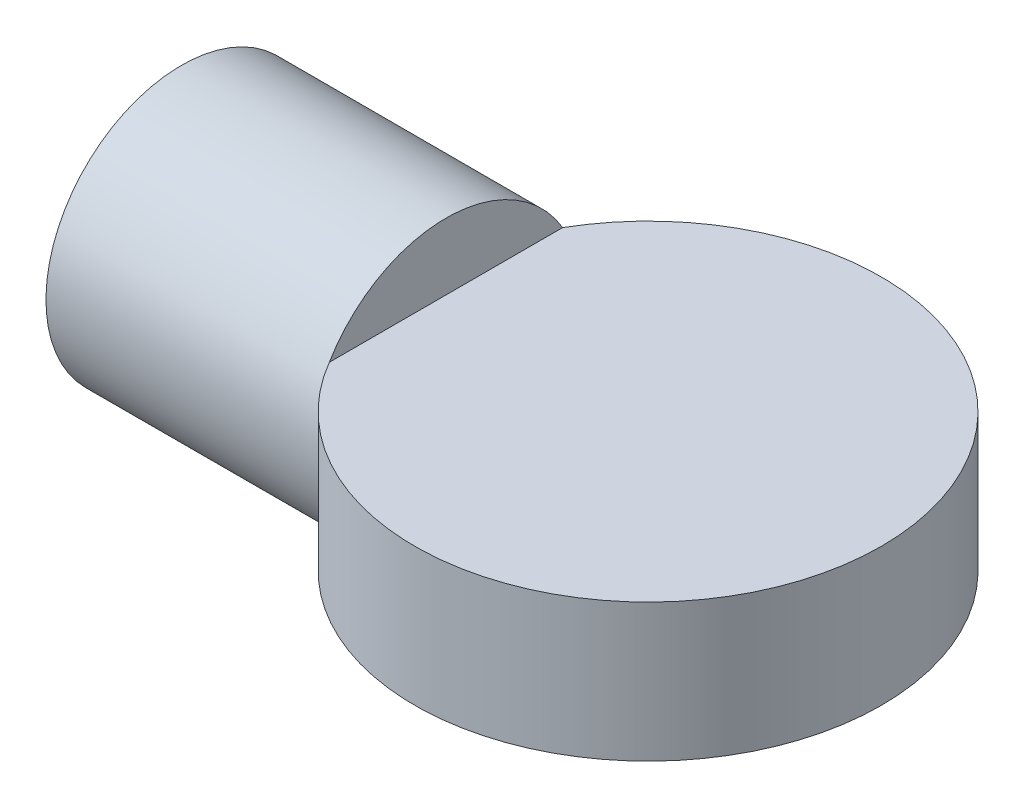
from build123d import *

# Parameters (mm, degrees)
BOSS_EXTRUDE1_DEPTH = 30
BOSS_EXTRUDE4_DEPTH = 57.60590949
BOSS_EXTRUDE5_DEPTH = 60.60590949


with BuildPart() as part:
    # Sketch1 → Boss-Extrude1 (new body)
    with BuildSketch(Plane(origin=(0, 0, 0), x_dir=(1, 0, 0), z_dir=(0, 1, 0))):
        with BuildLine():
            Line((-101.6, -25.4), (-43.994090512, -25.4))
            ThreePointArc((-43.994090512, -25.4), (50.8, 0), (-43.994090512, 25.4))
            Line((-43.994090512, 25.4), (-101.6, 25.4))
            Line((-101.6, 25.4), (-101.6, -25.4))
        make_face()
    extrude(amount=BOSS_EXTRUDE1_DEPTH)

    # Sketch4 → Boss-Extrude4 (add)
    with BuildSketch(Plane.ZY.offset(101.6)):
        with BuildLine():
            Line((-25.4, 30), (25.4, 30))
            ThreePointArc((25.4, 30), (0, 44.498474537), (-25.4, 30))
        make_face()
        with BuildLine():
            Line((25.4, 0), (-25.4, 0))
            ThreePointArc((-25.4, 0), (0, -14.498474537), (25.4, 0))
        make_face()
    extrude(amount=-BOSS_EXTRUDE4_DEPTH)

    # Sketch5 → Boss-Extrude5 (add)
    with BuildSketch(Plane.ZY.offset(101.6)):
        with BuildLine():
            Line((-25.4, 0), (-25.4, 30))
            ThreePointArc((-25.4, 30), (-29.498474537, 15), (-25.4, 0))
        make_face()
        with BuildLine():
            ThreePointArc((25.4, 0), (29.498474536, 15), (25.4, 30))
            Line((25.4, 30), (25.4, 0))
        make_face()
    extrude(amount=-BOSS_EXTRUDE5_DEPTH)


solid = part.part
